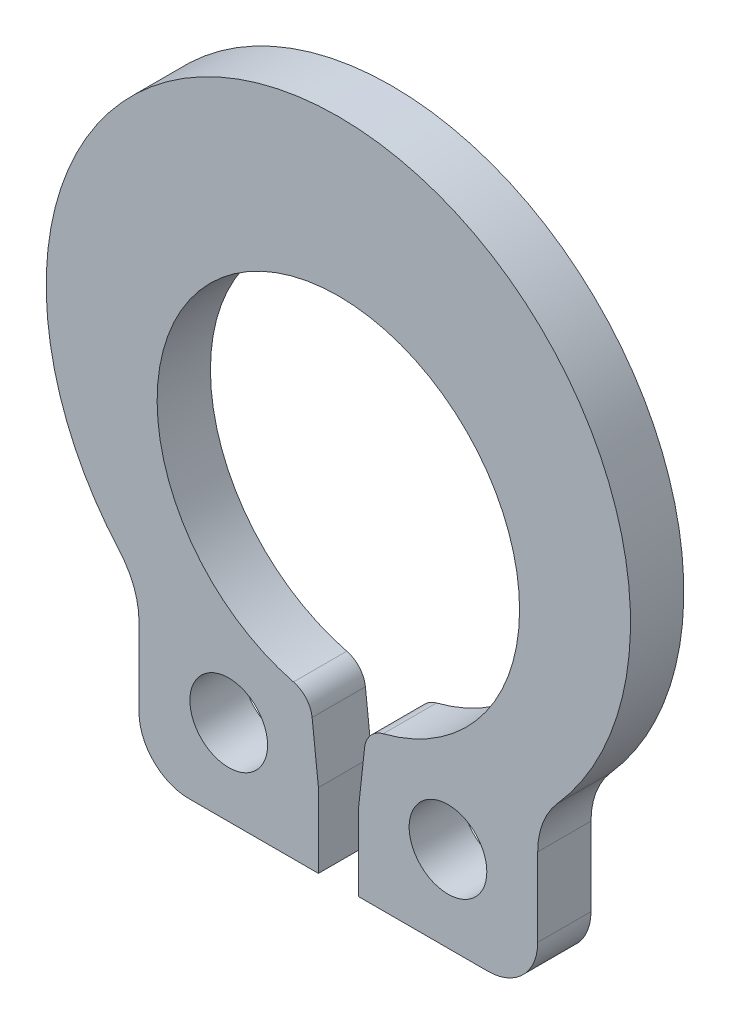
from build123d import *

# Parameters (mm, degrees)
SKETCH3_R               = 0.6477
BOSS_EXTRUDE1_DEPTH     = 0.4445
CUT_EXTRUDE1_DEPTH      = 8.446735617
CUT_EXTRUDE1_DEPTH_BACK = 8.446735617
FILLET1_R               = 0.4162425


with BuildPart() as part:
    # Sketch3 → Boss-Extrude1 (new, symmetric)
    with BuildSketch(Plane.XY):
        with BuildLine():
            Line((3.32486, -4.653915), (3.32486, -3.346426518))
            ThreePointArc((3.32486, -3.346426518), (3.408862886, -2.887538523), (3.649976862, -2.488165606))
            ThreePointArc((3.649976862, -2.488165606), (0, 5.6134), (-3.649976862, -2.488165606))
            ThreePointArc((-3.649976862, -2.488165606), (-3.408862886, -2.887538523), (-3.32486, -3.346426518))
            Line((-3.32486, -3.346426518), (-3.32486, -4.653915))
            ThreePointArc((-3.32486, -4.653915), (-3.081030789, -5.242570789), (-2.492375, -5.4864))
            Line((-2.492375, -5.4864), (-0.332486, -5.4864))
            Line((-0.332486, -5.4864), (-0.332486, -3.004257615))
            ThreePointArc((-0.332486, -3.004257615), (0, 3.0226), (0.332486, -3.004257615))
            Line((0.332486, -3.004257615), (0.332486, -5.4864))
            Line((0.332486, -5.4864), (2.492375, -5.4864))
            ThreePointArc((2.492375, -5.4864), (3.081030789, -5.242570789), (3.32486, -4.653915))
        make_face()
        with Locations((-1.828673, -4.057999533)):
            Circle(SKETCH3_R, mode=Mode.SUBTRACT)
        with Locations((1.828673, -4.057999533)):
            Circle(SKETCH3_R, mode=Mode.SUBTRACT)
    extrude(amount=BOSS_EXTRUDE1_DEPTH, both=True)

    # Sketch4 → Cut-Extrude1 (cut, two sides: drawn at the far end of the back side and taken through both)
    with BuildSketch(Plane.XY.offset(-CUT_EXTRUDE1_DEPTH_BACK)):
        Polygon((-0.332486, -4.245328808), (-0.797425121, 0), (0.797425121, 0), (0.332486, -4.245328808), align=None)
    extrude(amount=CUT_EXTRUDE1_DEPTH + CUT_EXTRUDE1_DEPTH_BACK, mode=Mode.SUBTRACT)

    # Fillet1
    fillet1_edges = [part.edges().sort_by_distance(p)[0] for p in [
        (0.470430427, -2.985767234, 0),
        (-0.470430427, -2.985767234, 0),
    ]]
    fillet(fillet1_edges, radius=FILLET1_R)


solid = part.part
